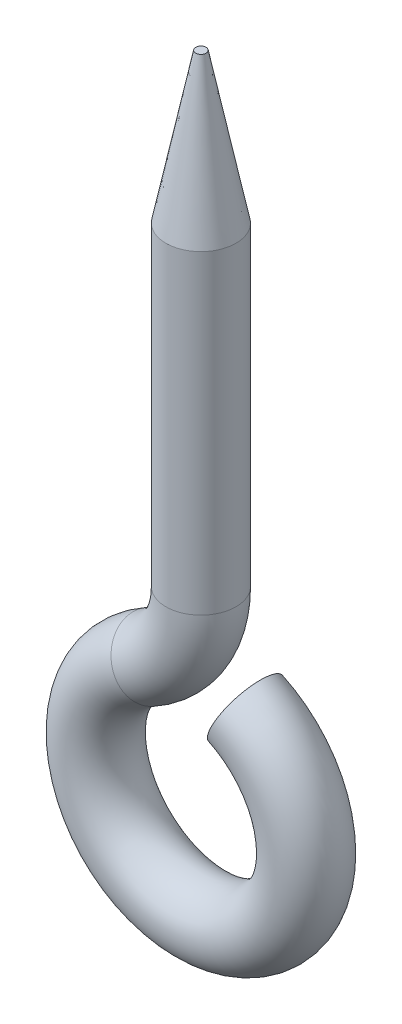
from build123d import *

# Parameters (mm, degrees)
SWEEP1_OUTLINE_R   = 1.190625
SWEEP1_ANGLE       = 61.036932
SWEEP1_2_OUTLINE_R = 1.190625
SWEEP1_2_ANGLE     = 306.036932
SWEEP1_START       = 6.059373847
SWEEP1_3_OUTLINE_R = 1.190625
SWEEP1_3_DEPTH     = 15.768751153
CHAMFER1_SIZE      = 5.08
CHAMFER1_SIZE2     = 1.016


with BuildPart() as part:
    # Sweep1: read off the stored shape, not the designer's step
    # Sweep1 outline → Sweep1 (revolve)
    with BuildSketch(Plane(origin=(-3.353661819, 6.059373947, 0), x_dir=(0.48424575692466937, -0.8749320241598509, 0), z_dir=(-0.8749320241598509, -0.48424575692466937, 0))):
        with Locations((3.353661819, 0)):
            Circle(SWEEP1_OUTLINE_R)
    revolve(axis=Axis((-3.353661819, 6.059373947, 0), (0, 0, 1)), revolution_arc=SWEEP1_ANGLE)

    # Sweep1 2 outline → Sweep1 2 (revolve)
    with BuildSketch(Plane(origin=(0, 0, 0), x_dir=(-0.48424575692467253, 0.8749320241598492, 0), z_dir=(0.8749320241598492, 0.48424575692467253, 0))):
        with Locations((3.571875, 0)):
            Circle(SWEEP1_2_OUTLINE_R)
    revolve(axis=Axis((0, 0, 0), (0, 0, 1)), revolution_arc=SWEEP1_2_ANGLE)

    # Sweep1 3 outline → Sweep1 3 (add)
    with BuildSketch(Plane(origin=(0, 0, 0), x_dir=(1, 0, 0), z_dir=(0, 1, 0)).offset(SWEEP1_START)):
        Circle(SWEEP1_3_OUTLINE_R)
    extrude(amount=SWEEP1_3_DEPTH)

    # Chamfer1
    chamfer1_edges = [part.edges().sort_by_distance(p)[0] for p in [
        (-1.190625, 21.828125, 0),
    ]]
    chamfer1_side = [part.faces().sort_by_distance(p)[0] for p in [
        (-1.190625, 13.943749423, 0),
    ]]
    chamfer(chamfer1_edges, length=CHAMFER1_SIZE, length2=CHAMFER1_SIZE2, reference=chamfer1_side[0])


solid = part.part
